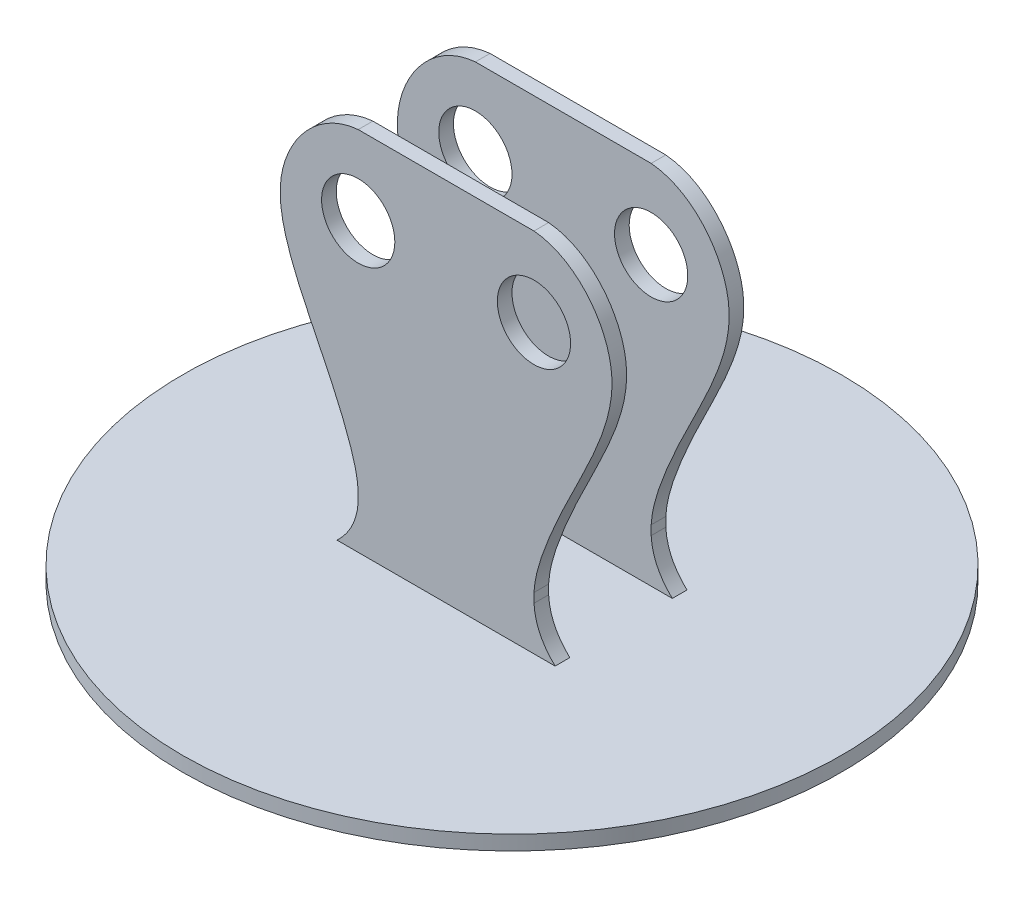
from build123d import *

# Parameters (mm, degrees)
SKETCH1_R           = 45
BOSS_EXTRUDE1_DEPTH = 2
SKETCH2_W           = 12
SKETCH2_H           = 2
BOSS_EXTRUDE2_DEPTH = 50
BOSS_EXTRUDE3_START = -2
BOSS_EXTRUDE3_DEPTH = 2
SKETCH4_R           = 5
CUT_EXTRUDE1_DEPTH  = 50


# Read off the part's stored shape, not the designer's step: Boss-Extrude3
with BuildPart() as part:
    # Sketch1 → Boss-Extrude1 (new body)
    with BuildSketch(Plane(origin=(0, 0, 0), x_dir=(1, 0, 0), z_dir=(0, 1, 0))):
        with Locations(Location((0, 0, 0), (0, 0, 270))):
            Circle(SKETCH1_R)
    extrude(amount=BOSS_EXTRUDE1_DEPTH)

    # Sketch2 → Boss-Extrude2 (add)
    with BuildSketch(Plane(origin=(0, 2, 0), x_dir=(1, 0, 0), z_dir=(0, 1, 0))):
        with Locations((-6, -8)):
            Rectangle(SKETCH2_W, SKETCH2_H)
    extrude(amount=BOSS_EXTRUDE2_DEPTH)

    # Boss-Extrude3 outline → Boss-Extrude3 (add)
    with BuildSketch(Plane.XY.offset(9).offset(BOSS_EXTRUDE3_START)):
        with BuildLine():
            Line((-12, 9.252585755), (-12, 52))
            add(Edge.make_bspline(
                [(-12, 52), (-17.707608273, 51.500079533), (-24.252880777, 43.259732346), (-21.397540076, 31.962524142), (-17.33880503, 23.974508646), (-13.768744124, 16.530528707), (-12.117269051, 11.269699014), (-12, 9.252585755)],
                knots=[0, 0, 0, 0, 0.28798008, 0.430455664, 0.586456405, 0.756216635, 0.864299894, 0.864299894, 0.864299894, 0.864299894], degree=3))
        make_face()
        with BuildLine():
            Line((-12, 2), (-12, 7.979725632))
            add(Edge.make_bspline(
                [(-12, 7.979725632), (-12.129131204, 5.890942784), (-12.929877772, 3.858184366), (-14.891007751, 2)],
                knots=[0.887122224, 0.887122224, 0.887122224, 0.887122224, 1, 1, 1, 1], degree=3))
            Line((-14.891007751, 2), (-12, 2))
        make_face()
    extrude(amount=BOSS_EXTRUDE3_DEPTH)

    # Sketch4 → Cut-Extrude1 (cut)
    with BuildSketch(Plane.XY.offset(9)):
        with Locations((-12, 41.201646807)):
            Circle(SKETCH4_R)
    extrude(amount=-CUT_EXTRUDE1_DEPTH, mode=Mode.SUBTRACT)

    # Mirror1: part across plane


with BuildPart() as part_1:
    add(part.part)
    add(part.part.mirror(Plane(origin=(0, 52, 0), x_dir=(0, 0, 1), z_dir=(1, 0, 0))))

    # Mirror2: part across plane


with BuildPart() as part_2:
    add(part_1.part)
    add(part_1.part.mirror(Plane.XY))


solid = part_2.part
